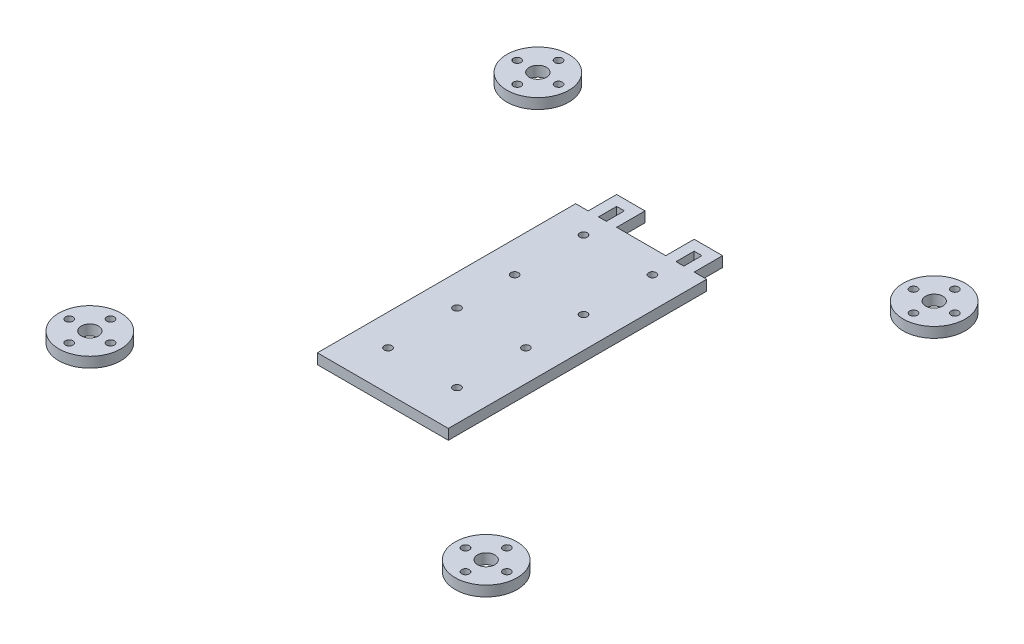
from build123d import *

# Parameters (mm, degrees)
SKETCH1_W             = 2.25
SKETCH1_H             = 5.25
SKETCH1_R             = 1.1
BOSS_EXTRUDE1_DEPTH   = 3
SKETCH1_R_2           = 9
SKETCH1_R_3           = 2.5
BOSS_EXTRUDE1_2_DEPTH = 3
BOSS_EXTRUDE1_3_DEPTH = 3
BOSS_EXTRUDE1_4_DEPTH = 3
BOSS_EXTRUDE1_5_DEPTH = 3


with BuildPart() as part:
    # Sketch1 → Boss-Extrude1 (new body)
    with BuildSketch(Plane(origin=(0, 0, 0), x_dir=(1, 0, 0), z_dir=(0, 1, 0))):
        Polygon((19, -37.475), (19, 37.475), (15.375, 37.475), (15.375, 45.725), (7.125, 45.725), (7.125, 37.475), (-7.125, 37.475), (-7.125, 45.725), (-15.375, 45.725), (-15.375, 37.475), (-19, 37.475), (-19, -37.475), align=None)
        with Locations((-11.25, 40.1)):
            Rectangle(SKETCH1_W, SKETCH1_H, mode=Mode.SUBTRACT)
        with Locations((11.25, 40.1)):
            Rectangle(SKETCH1_W, SKETCH1_H, mode=Mode.SUBTRACT)
        with Locations((10, -5.975)):
            Circle(SKETCH1_R, mode=Mode.SUBTRACT)
        with Locations((-10, -5.975)):
            Circle(SKETCH1_R, mode=Mode.SUBTRACT)
        with Locations((-10, -25.975)):
            Circle(SKETCH1_R, mode=Mode.SUBTRACT)
        with Locations((10, -25.975)):
            Circle(SKETCH1_R, mode=Mode.SUBTRACT)
        with Locations((10, 30.75)):
            Circle(SKETCH1_R, mode=Mode.SUBTRACT)
        with Locations((-10, 30.75)):
            Circle(SKETCH1_R, mode=Mode.SUBTRACT)
        with Locations((-10, 10.75)):
            Circle(SKETCH1_R, mode=Mode.SUBTRACT)
        with Locations((10, 10.75)):
            Circle(SKETCH1_R, mode=Mode.SUBTRACT)
    extrude(amount=BOSS_EXTRUDE1_DEPTH)


with BuildPart() as body_2:
    # Sketch1 → Boss-Extrude1 2 (new body)
    with BuildSketch(Plane(origin=(0, 0, 0), x_dir=(1, 0, 0), z_dir=(0, 1, 0))):
        with Locations((-57.5, -65)):
            Circle(SKETCH1_R_2)
        with Locations((-57.5, -59)):
            Circle(SKETCH1_R, mode=Mode.SUBTRACT)
        with Locations((-57.5, -65)):
            Circle(SKETCH1_R_3, mode=Mode.SUBTRACT)
        with Locations((-51.5, -65)):
            Circle(SKETCH1_R, mode=Mode.SUBTRACT)
        with Locations((-63.5, -65)):
            Circle(SKETCH1_R, mode=Mode.SUBTRACT)
        with Locations((-57.5, -71)):
            Circle(SKETCH1_R, mode=Mode.SUBTRACT)
    extrude(amount=BOSS_EXTRUDE1_2_DEPTH)


with BuildPart() as body_3:
    # Sketch1 → Boss-Extrude1 3 (new body)
    with BuildSketch(Plane(origin=(0, 0, 0), x_dir=(1, 0, 0), z_dir=(0, 1, 0))):
        with Locations((57.5, -65)):
            Circle(SKETCH1_R_2)
        with Locations((57.5, -59)):
            Circle(SKETCH1_R, mode=Mode.SUBTRACT)
        with Locations((57.5, -65)):
            Circle(SKETCH1_R_3, mode=Mode.SUBTRACT)
        with Locations((51.5, -65)):
            Circle(SKETCH1_R, mode=Mode.SUBTRACT)
        with Locations((57.5, -71)):
            Circle(SKETCH1_R, mode=Mode.SUBTRACT)
        with Locations((63.5, -65)):
            Circle(SKETCH1_R, mode=Mode.SUBTRACT)
    extrude(amount=BOSS_EXTRUDE1_3_DEPTH)


with BuildPart() as body_4:
    # Sketch1 → Boss-Extrude1 4 (new body)
    with BuildSketch(Plane(origin=(0, 0, 0), x_dir=(1, 0, 0), z_dir=(0, 1, 0))):
        with Locations((-57.5, 65)):
            Circle(SKETCH1_R_2)
        with Locations((-51.5, 65)):
            Circle(SKETCH1_R, mode=Mode.SUBTRACT)
        with Locations((-57.5, 71)):
            Circle(SKETCH1_R, mode=Mode.SUBTRACT)
        with Locations((-63.5, 65)):
            Circle(SKETCH1_R, mode=Mode.SUBTRACT)
        with Locations((-57.5, 59)):
            Circle(SKETCH1_R, mode=Mode.SUBTRACT)
        with Locations((-57.5, 65)):
            Circle(SKETCH1_R_3, mode=Mode.SUBTRACT)
    extrude(amount=BOSS_EXTRUDE1_4_DEPTH)


with BuildPart() as body_5:
    # Sketch1 → Boss-Extrude1 5 (new body)
    with BuildSketch(Plane(origin=(0, 0, 0), x_dir=(1, 0, 0), z_dir=(0, 1, 0))):
        with Locations((57.5, 65)):
            Circle(SKETCH1_R_2)
        with Locations((51.5, 65)):
            Circle(SKETCH1_R, mode=Mode.SUBTRACT)
        with Locations((57.5, 65)):
            Circle(SKETCH1_R_3, mode=Mode.SUBTRACT)
        with Locations((57.5, 59)):
            Circle(SKETCH1_R, mode=Mode.SUBTRACT)
        with Locations((57.5, 71)):
            Circle(SKETCH1_R, mode=Mode.SUBTRACT)
        with Locations((63.5, 65)):
            Circle(SKETCH1_R, mode=Mode.SUBTRACT)
    extrude(amount=BOSS_EXTRUDE1_5_DEPTH)


solid = Compound([part.part, body_2.part, body_3.part, body_4.part, body_5.part])
